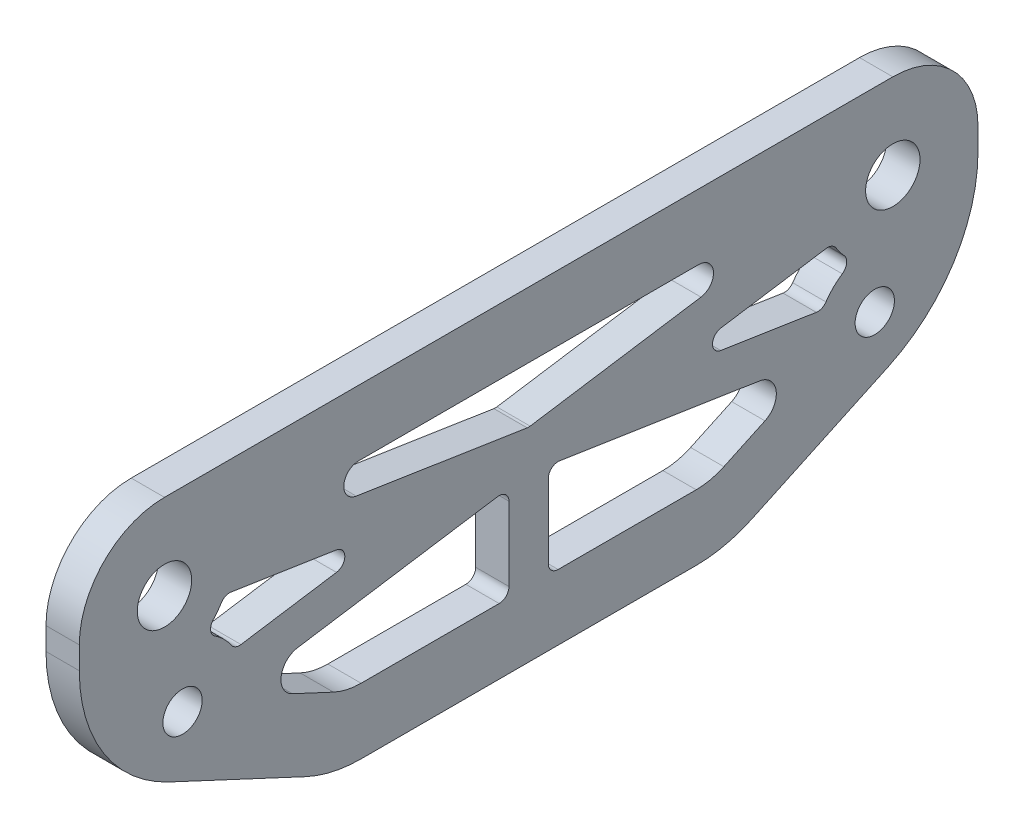
from build123d import *

# Parameters (mm, degrees)
SKETCH1_R           = 2.075
SKETCH1_R_2         = 1.5
BOSS_EXTRUDE1_DEPTH = 2.54
FILLET1_R           = 10
CUT_EXTRUDE2_DEPTH  = 37.545452851
FILLET2_R           = 0.75


with BuildPart() as part:
    # Sketch1 → Boss-Extrude1 (new body)
    with BuildSketch(Plane(origin=(0, 0, 0), x_dir=(0, 0, -1), z_dir=(1, 0, 0))):
        with BuildLine():
            Line((15, 12.39309195), (27.786, 12.39309195))
            ThreePointArc((27.786, 12.39309195), (32.382194078, 10.489286028), (34.286, 5.89309195))
            Line((34.286, 5.89309195), (34.286, 4.184528871))
            ThreePointArc((34.286, 4.184528871), (32.42155307, -2.212098763), (27.412188955, -6.605193186))
            Line((27.412188955, -6.605193186), (15, -12.39309195))
            Line((15, -12.39309195), (-15, -12.39309195))
            Line((-15, -12.39309195), (-27.412188955, -6.605193186))
            ThreePointArc((-27.412188955, -6.605193186), (-32.42155307, -2.212098763), (-34.286, 4.184528871))
            Line((-34.286, 4.184528871), (-34.286, 5.89309195))
            ThreePointArc((-34.286, 5.89309195), (-32.382194078, 10.489286028), (-27.786, 12.39309195))
            Line((-27.786, 12.39309195), (-15, 12.39309195))
            Line((-15, 12.39309195), (15, 12.39309195))
        make_face()
        with Locations((27.786, 5.89309195)):
            Circle(SKETCH1_R, mode=Mode.SUBTRACT)
        with Locations((-27.786, 5.89309195)):
            Circle(SKETCH1_R, mode=Mode.SUBTRACT)
        with Locations((26.408341914, -2.455659494)):
            Circle(SKETCH1_R_2, mode=Mode.SUBTRACT)
        with Locations((-26.408341914, -2.455659494)):
            Circle(SKETCH1_R_2, mode=Mode.SUBTRACT)
    extrude(amount=BOSS_EXTRUDE1_DEPTH)

    # Fillet1
    fillet1_edges = [part.edges().sort_by_distance(p)[0] for p in [
        (1.27, -12.39309195, -15),
        (1.27, -12.39309195, 15),
    ]]
    fillet(fillet1_edges, radius=FILLET1_R)

    # Sketch2 → Cut-Extrude2 (cut, through all)
    with BuildSketch(Plane(origin=(0, 0, 0), x_dir=(0, 0, -1), z_dir=(1, 0, 0))):
        with BuildLine():
            ThreePointArc((-24.838616464, 1.761681139), (-23.450545994, 0.935718293), (-22.443549807, -0.327180331))
            Line((-22.443549807, -0.327180331), (-9.851828054, 1.612600677))
            Line((-9.851828054, 1.612600677), (-23.222649445, 3.672403609))
            ThreePointArc((-23.222649445, 3.672403609), (-23.91101655, 2.615878459), (-24.838616464, 1.761681139))
        make_face()
        with BuildLine():
            ThreePointArc((-17.626291895, -2.620461033), (-18.882865231, -3.891072498), (-18.031835278, -5.462434347))
            Line((-18.031835278, -5.462434347), (-14.896144682, -6.924630885))
            ThreePointArc((-14.896144682, -6.924630885), (-13.865251443, -7.274571986), (-12.783053374, -7.39309195))
            Line((-12.783053374, -7.39309195), (-1.5, -7.39309195))
            Line((-1.5, -7.39309195), (-1.5, -0.13617212))
            Line((-1.5, -0.13617212), (-17.626291895, -2.620461033))
        make_face()
        with BuildLine():
            Line((-13.15083053, 5.156208225), (0, 3.130295344))
            Line((0, 3.130295344), (13.15083053, 5.156208225))
            ThreePointArc((13.15083053, 5.156208225), (14.10125866, 6.35398668), (12.979542522, 7.39309195))
            Line((12.979542522, 7.39309195), (-12.979542522, 7.39309195))
            ThreePointArc((-12.979542522, 7.39309195), (-14.10125866, 6.35398668), (-13.15083053, 5.156208225))
        make_face()
        with BuildLine():
            Line((17.626291895, -2.620461033), (1.5, -0.13617212))
            Line((1.5, -0.13617212), (1.5, -7.39309195))
            Line((1.5, -7.39309195), (12.783053374, -7.39309195))
            ThreePointArc((12.783053374, -7.39309195), (13.865251443, -7.274571986), (14.896144682, -6.924630885))
            Line((14.896144682, -6.924630885), (18.031835278, -5.462434347))
            ThreePointArc((18.031835278, -5.462434347), (18.882865231, -3.891072498), (17.626291895, -2.620461033))
        make_face()
        with BuildLine():
            Line((23.222649445, 3.672403609), (9.851828054, 1.612600677))
            Line((9.851828054, 1.612600677), (22.443549807, -0.327180331))
            ThreePointArc((22.443549807, -0.327180331), (23.450545994, 0.935718293), (24.838616464, 1.761681139))
            ThreePointArc((24.838616464, 1.761681139), (23.91101655, 2.615878459), (23.222649445, 3.672403609))
        make_face()
    extrude(amount=CUT_EXTRUDE2_DEPTH, mode=Mode.SUBTRACT)

    # Fillet2
    fillet2_edges = [part.edges().sort_by_distance(p)[0] for p in [
        (1.27, -7.39309195, -1.5),
        (1.27, 3.672403609, -23.222649445),
        (1.27, 1.612600677, -9.851828054),
        (1.27, 3.672403609, 23.222649445),
        (1.27, 3.130295344, 0),
        (1.27, -0.13617212, -1.5),
        (1.27, -7.39309195, 1.5),
        (1.27, -0.13617212, 1.5),
        (1.27, 1.612600677, 9.851828054),
        (1.27, -0.327180331, -22.443549807),
        (1.27, 1.761681139, -24.838616464),
        (1.27, -0.327180331, 22.443549807),
        (1.27, 1.761681139, 24.838616464),
    ]]
    fillet(fillet2_edges, radius=FILLET2_R)


solid = part.part
